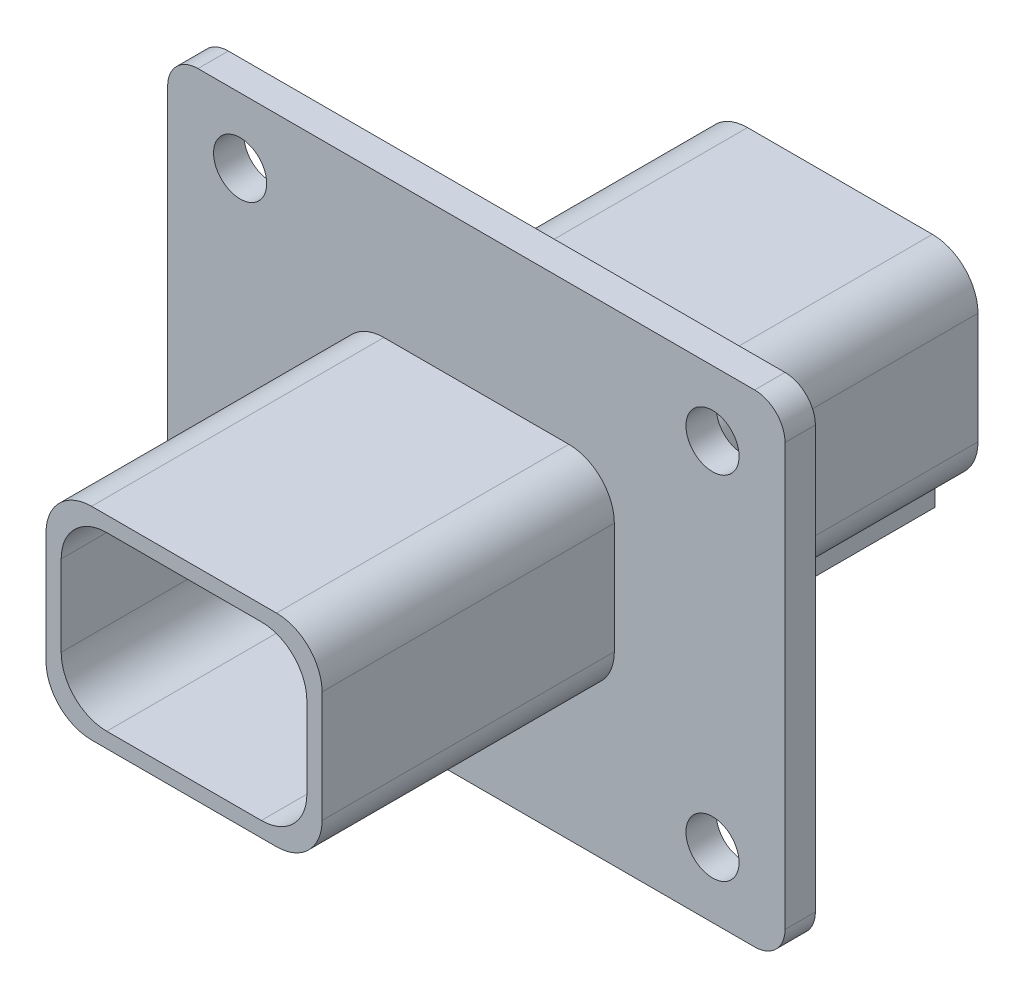
from build123d import *
from OCP.BRepAlgoAPI import BRepAlgoAPI_Cut
from OCP.TopTools import TopTools_ListOfShape

# Parameters (mm, degrees)
SKETCH1_W           = 40.66
SKETCH1_H           = 31.77
SKETCH1_R           = 1.75
BOSS_EXTRUDE1_DEPTH = 2
SKETCH2_W           = 16.18
SKETCH2_H           = 11.33
BOSS_EXTRUDE2_DEPTH = 21.95
SKETCH3_W           = 18.18
SKETCH3_H           = 13.33
SKETCH3_W_2         = 16.18
SKETCH3_H_2         = 11.33
BOSS_EXTRUDE3_DEPTH = 19.25
FILLET2_START       = -21.95
FILLET2_DEPTH       = 21.95
FILLET2_START_2     = 2
FILLET2_2_DEPTH     = 19.25
FILLET2_3_DEPTH     = 43.2
FILLET3_R           = 2


with BuildPart() as part:
    # Sketch1 → Boss-Extrude1 (new body)
    with BuildSketch(Plane.XY):
        Rectangle(SKETCH1_W, SKETCH1_H)
        with Locations((-15.555, 11.585)):
            Circle(SKETCH1_R, mode=Mode.SUBTRACT)
        with Locations((-15.555, -11.585)):
            Circle(SKETCH1_R, mode=Mode.SUBTRACT)
        with Locations((15.555, -11.585)):
            Circle(SKETCH1_R, mode=Mode.SUBTRACT)
        with Locations((15.555, 11.585)):
            Circle(SKETCH1_R, mode=Mode.SUBTRACT)
    extrude(amount=BOSS_EXTRUDE1_DEPTH)

    # Sketch2 → Boss-Extrude2 (add)
    with BuildSketch(Plane(origin=(0, 0, 0), x_dir=(-1, 0, 0), z_dir=(0, 0, -1))):
        Polygon((6.245, -6.665), (9.09, -6.665), (9.09, 6.665), (-9.09, 6.665), (-9.09, -6.665), (-6.245, -6.665), (-6.245, -8.835), (6.245, -8.835), align=None)
        Rectangle(SKETCH2_W, SKETCH2_H, mode=Mode.SUBTRACT)
    extrude(amount=BOSS_EXTRUDE2_DEPTH)

    # Sketch3 → Boss-Extrude3 (add)
    with BuildSketch(Plane.XY.offset(2)):
        Rectangle(SKETCH3_W, SKETCH3_H)
        Rectangle(SKETCH3_W_2, SKETCH3_H_2, mode=Mode.SUBTRACT)
    extrude(amount=BOSS_EXTRUDE3_DEPTH)


with BuildPart() as fillet2_tool:
    # Fillet2: read off the stored shape, not the designer's step
    # Fillet2 outline → Fillet2 (new body)
    with BuildSketch(Plane.XY.offset(FILLET2_START)):
        with BuildLine():
            Line((-9.09, -6.665), (-6.245, -6.665))
            ThreePointArc((-6.245, -6.665), (-8.265430992, -5.734799668), (-9.09, -3.669006842))
            Line((-9.09, -3.669006842), (-9.09, -6.665))
        make_face()
        with BuildLine():
            Line((-9.09, 6.665), (-9.09, 3.665))
            ThreePointArc((-9.09, 3.665), (-8.211320344, 5.786320344), (-6.09, 6.665))
            Line((-6.09, 6.665), (-9.09, 6.665))
        make_face()
        with BuildLine():
            Line((9.09, -6.665), (9.09, -3.669006842))
            ThreePointArc((9.09, -3.669006842), (8.265430992, -5.734799668), (6.245, -6.665))
            Line((6.245, -6.665), (9.09, -6.665))
        make_face()
        with BuildLine():
            Line((9.09, 6.665), (6.09, 6.665))
            ThreePointArc((6.09, 6.665), (8.211320344, 5.786320344), (9.09, 3.665))
            Line((9.09, 3.665), (9.09, 6.665))
        make_face()
    extrude(amount=FILLET2_DEPTH)


with BuildPart() as part_1:
    add(part.part)

    # Fillet2: cut by fillet2_tool, with a tolerance
    fillet2_stock = TopTools_ListOfShape()
    fillet2_stock.Append(part_1.part.wrapped)
    fillet2_tools = TopTools_ListOfShape()
    fillet2_tools.Append(fillet2_tool.part.wrapped)
    fillet2_cut = BRepAlgoAPI_Cut()
    fillet2_cut.SetArguments(fillet2_stock)
    fillet2_cut.SetTools(fillet2_tools)
    fillet2_cut.SetFuzzyValue(0.00001)
    fillet2_cut.Build()
    add(Compound.cast(fillet2_cut.Shape()).solids(), mode=Mode.REPLACE)


with BuildPart() as fillet2_2_tool:
    # Fillet2 2 outline → Fillet2 2 (new body)
    with BuildSketch(Plane.XY.offset(FILLET2_START_2)):
        with BuildLine():
            Line((-9.09, -6.665), (-6.09, -6.665))
            ThreePointArc((-6.09, -6.665), (-8.209903239, -5.787736503), (-9.089997324, -3.669006838))
            Line((-9.089997324, -3.669006838), (-9.09, -6.665))
        make_face()
        with BuildLine():
            ThreePointArc((9.089997324, -3.669006838), (8.209903239, -5.787736503), (6.09, -6.665))
            Line((6.09, -6.665), (9.09, -6.665))
            Line((9.09, -6.665), (9.089997324, -3.669006838))
        make_face()
        with BuildLine():
            Line((-9.09, 6.665), (-9.09, 3.665))
            ThreePointArc((-9.09, 3.665), (-8.211320344, 5.786320344), (-6.09, 6.665))
            Line((-6.09, 6.665), (-9.09, 6.665))
        make_face()
        with BuildLine():
            Line((9.09, 6.665), (6.09, 6.665))
            ThreePointArc((6.09, 6.665), (8.211320344, 5.786320344), (9.09, 3.665))
            Line((9.09, 3.665), (9.09, 6.665))
        make_face()
    extrude(amount=FILLET2_2_DEPTH)


with BuildPart() as part_2:
    add(part_1.part)

    # Fillet2 2: cut by fillet2_2_tool, with a tolerance
    fillet2_2_stock = TopTools_ListOfShape()
    fillet2_2_stock.Append(part_2.part.wrapped)
    fillet2_2_tools = TopTools_ListOfShape()
    fillet2_2_tools.Append(fillet2_2_tool.part.wrapped)
    fillet2_2_cut = BRepAlgoAPI_Cut()
    fillet2_2_cut.SetArguments(fillet2_2_stock)
    fillet2_2_cut.SetTools(fillet2_2_tools)
    fillet2_2_cut.SetFuzzyValue(0.00001)
    fillet2_2_cut.Build()
    add(Compound.cast(fillet2_2_cut.Shape()).solids(), mode=Mode.REPLACE)


with BuildPart() as fillet2_3_tool:
    # Fillet2 3 outline → Fillet2 3 (new body)
    with BuildSketch(Plane.XY.offset(FILLET2_START)):
        with BuildLine():
            Line((-8.09, -5.665), (-5.09, -5.665))
            ThreePointArc((-5.09, -5.665), (-7.211320344, -4.786320344), (-8.09, -2.665))
            Line((-8.09, -2.665), (-8.09, -5.665))
        make_face()
        with BuildLine():
            ThreePointArc((8.09, -2.665), (7.211320344, -4.786320344), (5.09, -5.665))
            Line((5.09, -5.665), (8.09, -5.665))
            Line((8.09, -5.665), (8.09, -2.665))
        make_face()
        with BuildLine():
            Line((-8.09, 5.665), (-8.09, 2.665))
            ThreePointArc((-8.09, 2.665), (-7.211320344, 4.786320344), (-5.09, 5.665))
            Line((-5.09, 5.665), (-8.09, 5.665))
        make_face()
        with BuildLine():
            ThreePointArc((5.09, 5.665), (7.211320344, 4.786320344), (8.09, 2.665))
            Line((8.09, 2.665), (8.09, 5.665))
            Line((8.09, 5.665), (5.09, 5.665))
        make_face()
    extrude(amount=FILLET2_3_DEPTH)


with BuildPart() as part_3:
    add(part_2.part)


with BuildPart() as part_4:
    # Fillet2 3: joined with fillet2_3_tool
    add(part_3.part.fuse(fillet2_3_tool.part, tol=0.00001))

    # Fillet3
    fillet3_edges = [part_4.edges().sort_by_distance(p)[0] for p in [
        (-20.33, 15.885, 1),
        (20.33, 15.885, 1),
        (20.33, -15.885, 1),
        (-20.33, -15.885, 1),
    ]]
    fillet(fillet3_edges, radius=FILLET3_R)


solid = part_4.part
